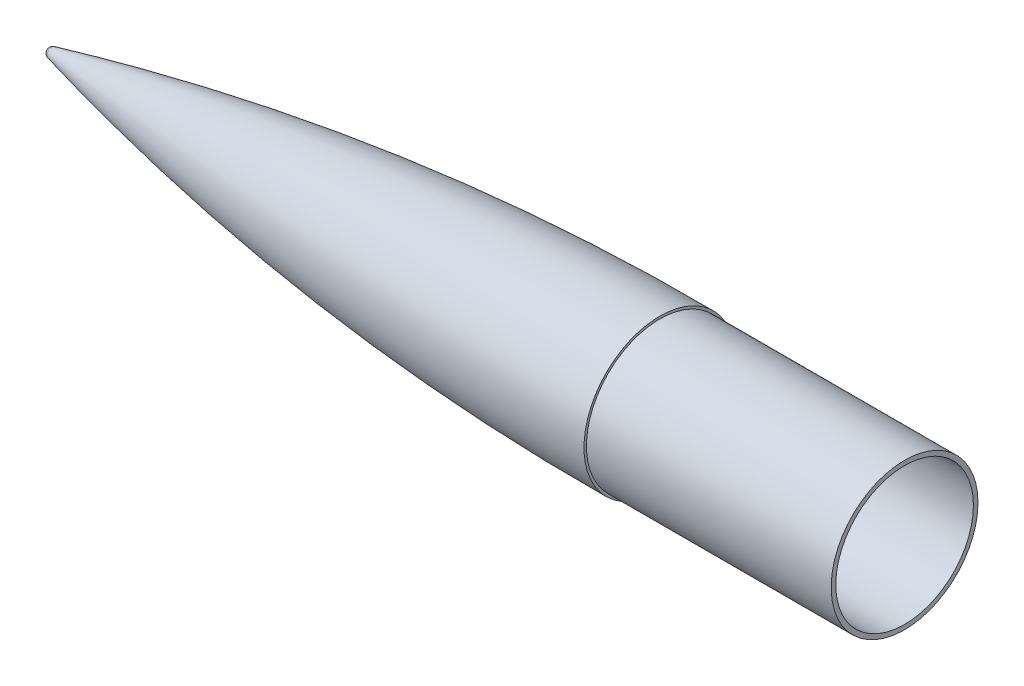
from build123d import *


with BuildPart() as part:
    # Sketch1 → Revolve1 (revolve)
    with BuildSketch(Plane.XY):
        with BuildLine():
            Line((325.525034954, 38.1), (452.525034954, 38.1))
            Line((452.525034954, 38.1), (452.525034954, 35.71875))
            Line((452.525034954, 35.71875), (325.525034954, 35.71875))
            Line((325.525034954, 35.71875), (325.510697418, 36.988793164))
            ThreePointArc((325.510697418, 36.988793164), (166.566791256, 28.186849244), (9.894709976, 0))
            Line((9.894709976, 0), (8.025034954, 0))
            ThreePointArc((8.025034954, 0), (8.567797441, 1.569280827), (9.964123391, 2.467894911))
            ThreePointArc((9.964123391, 2.467894911), (166.61365154, 30.589847094), (325.525034954, 39.37))
            Line((325.525034954, 39.37), (325.525034954, 38.1))
        make_face()
    revolve(axis=Axis((325.525034954, 0, 0), (-1, 0, 0)))


solid = part.part
